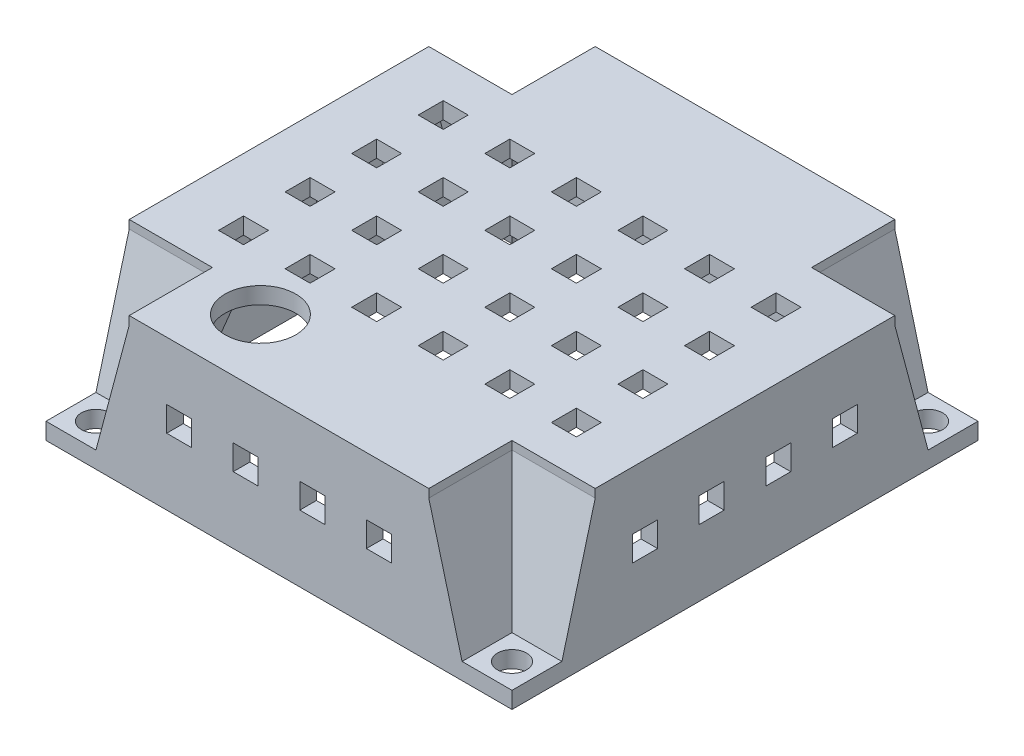
from build123d import *
from OCP.BRepFilletAPI import BRepFilletAPI_MakeChamfer

# Parameters (mm, degrees)
SKETCH_1_W                  = 56
SKETCH_1_H                  = 56
EXTRUDE_1_DEPTH             = 18
SKETCH_2_W                  = 11
SKETCH_2_H                  = 11
CUT_EXTRUDE_2_DEPTH         = 16
CHAMFER_1_SIZE              = 15
CHAMFER_1_SIZE2             = 4
SKETCH_5_R                  = 1.75
CUT_EXTRUDE_4_DEPTH         = 15
SKETCH_6_W                  = 3
SKETCH_6_H                  = 3
CUT_EXTRUDE_5_DEPTH         = 2
PATTERN_LINEAR_1_COUNT      = 6
PATTERN_LINEAR_1_PITCH      = 8
PATTERN_LINEAR_1_COUNT_DIR2 = 4
PATTERN_LINEAR_1_PITCH_DIR2 = 8
SKETCH_7_W                  = 3
SKETCH_7_H                  = 3
CUT_EXTRUDE_6_DEPTH         = 66.1459899
PATTERN_LINEAR_2_COUNT      = 4
PATTERN_LINEAR_2_PITCH      = 8
SKETCH_8_W                  = 3
SKETCH_8_H                  = 3
CUT_EXTRUDE_7_DEPTH         = 66.145989943
PATTERN_LINEAR_3_COUNT      = 4
PATTERN_LINEAR_3_PITCH      = 8
SKETCH_9_R                  = 4.25
CUT_EXTRUDE_8_DEPTH         = 10


with BuildPart() as part:
    # Эскиз1 → Бобышка-Вытянуть1 (new body)
    with BuildSketch(Plane(origin=(0, 0, 0), x_dir=(1, 0, 0), z_dir=(0, 1, 0))):
        Rectangle(SKETCH_1_W, SKETCH_1_H)
    extrude(amount=EXTRUDE_1_DEPTH)

    # Эскиз2 → Вырез-Вытянуть2 (cut)
    with BuildSketch(Plane(origin=(0, 18, 0), x_dir=(1, 0, 0), z_dir=(0, 1, 0))):
        with Locations((-23.5, 23.5)):
            Rectangle(SKETCH_2_W, SKETCH_2_H)
        with Locations((23.5, 23.5)):
            Rectangle(SKETCH_2_W, SKETCH_2_H)
        with Locations((-23.5, -23.5)):
            Rectangle(SKETCH_2_W, SKETCH_2_H)
        with Locations((23.5, -23.5)):
            Rectangle(SKETCH_2_W, SKETCH_2_H)
    extrude(amount=-CUT_EXTRUDE_2_DEPTH, mode=Mode.SUBTRACT)

    # Фаска1: one chamfer whose edges measure the first distance from different faces: ONE call of the kernel's chamfer builder (chamfer() names one face for all edges)
    chamfer_1_edges_1 = [part.edges().sort_by_distance(p)[0] for p in [
        (23, 2, -18),
    ]]
    chamfer_1_side_1 = [part.faces().sort_by_distance(p)[0] for p in [
        (23, 10, -18),
    ]]
    chamfer_1_edges_2 = [part.edges().sort_by_distance(p)[0] for p in [
        (18, 2, -23),
    ]]
    chamfer_1_side_2 = [part.faces().sort_by_distance(p)[0] for p in [
        (18, 10, -23),
    ]]
    chamfer_1_edges_3 = [part.edges().sort_by_distance(p)[0] for p in [
        (-23, 2, 18),
    ]]
    chamfer_1_side_3 = [part.faces().sort_by_distance(p)[0] for p in [
        (-23, 10, 18),
    ]]
    chamfer_1_edges_4 = [part.edges().sort_by_distance(p)[0] for p in [
        (-18, 2, 23),
    ]]
    chamfer_1_side_4 = [part.faces().sort_by_distance(p)[0] for p in [
        (-18, 10, 23),
    ]]
    chamfer_1_edges_5 = [part.edges().sort_by_distance(p)[0] for p in [
        (18, 2, 23),
    ]]
    chamfer_1_side_5 = [part.faces().sort_by_distance(p)[0] for p in [
        (18, 10, 23),
    ]]
    chamfer_1_edges_6 = [part.edges().sort_by_distance(p)[0] for p in [
        (23, 2, 18),
    ]]
    chamfer_1_side_6 = [part.faces().sort_by_distance(p)[0] for p in [
        (23, 10, 18),
    ]]
    chamfer_1_edges_7 = [part.edges().sort_by_distance(p)[0] for p in [
        (-18, 2, -23),
    ]]
    chamfer_1_side_7 = [part.faces().sort_by_distance(p)[0] for p in [
        (-18, 10, -23),
    ]]
    chamfer_1_edges_8 = [part.edges().sort_by_distance(p)[0] for p in [
        (-23, 2, -18),
    ]]
    chamfer_1_side_8 = [part.faces().sort_by_distance(p)[0] for p in [
        (-23, 10, -18),
    ]]
    chamfer_1 = BRepFilletAPI_MakeChamfer(part.part.solid().wrapped)
    for e in chamfer_1_edges_1:
        chamfer_1.Add(CHAMFER_1_SIZE, CHAMFER_1_SIZE2, e.wrapped, chamfer_1_side_1[0].wrapped)  # the first distance lies on this face
    for e in chamfer_1_edges_2:
        chamfer_1.Add(CHAMFER_1_SIZE, CHAMFER_1_SIZE2, e.wrapped, chamfer_1_side_2[0].wrapped)  # the first distance lies on this face
    for e in chamfer_1_edges_3:
        chamfer_1.Add(CHAMFER_1_SIZE, CHAMFER_1_SIZE2, e.wrapped, chamfer_1_side_3[0].wrapped)  # the first distance lies on this face
    for e in chamfer_1_edges_4:
        chamfer_1.Add(CHAMFER_1_SIZE, CHAMFER_1_SIZE2, e.wrapped, chamfer_1_side_4[0].wrapped)  # the first distance lies on this face
    for e in chamfer_1_edges_5:
        chamfer_1.Add(CHAMFER_1_SIZE, CHAMFER_1_SIZE2, e.wrapped, chamfer_1_side_5[0].wrapped)  # the first distance lies on this face
    for e in chamfer_1_edges_6:
        chamfer_1.Add(CHAMFER_1_SIZE, CHAMFER_1_SIZE2, e.wrapped, chamfer_1_side_6[0].wrapped)  # the first distance lies on this face
    for e in chamfer_1_edges_7:
        chamfer_1.Add(CHAMFER_1_SIZE, CHAMFER_1_SIZE2, e.wrapped, chamfer_1_side_7[0].wrapped)  # the first distance lies on this face
    for e in chamfer_1_edges_8:
        chamfer_1.Add(CHAMFER_1_SIZE, CHAMFER_1_SIZE2, e.wrapped, chamfer_1_side_8[0].wrapped)  # the first distance lies on this face
    add(Compound.cast(chamfer_1.Shape()), mode=Mode.REPLACE)

    # Оболочка2: read off the stored shape, not the designer's step
    # Оболочка2: loft between two sections, ruled curve by curve
    shell_2_from = [
        Edge.make_line((-26, 0, -20.463443374), (-26, 0, 20.463443374)),
        Edge.make_line((20.463443374, 0, 26), (-20.463443374, 0, 26)),
        Edge.make_line((26, 0, 20.463443374), (26, 0, -20.463443374)),
        Edge.make_line((-20.463443374, 0, -26), (20.463443374, 0, -26)),
        Edge.make_line((26, 0, 20.463443374), (20.463443374, 0, 20.463443374)),
        Edge.make_line((-26, 0, 20.463443374), (-20.463443374, 0, 20.463443374)),
        Edge.make_line((20.463443374, 0, 20.463443374), (20.463443374, 0, 26)),
        Edge.make_line((20.463443374, 0, -26), (20.463443374, 0, -20.463443374)),
        Edge.make_line((-20.463443374, 0, 26), (-20.463443374, 0, 20.463443374)),
        Edge.make_line((-20.463443374, 0, -26), (-20.463443374, 0, -20.463443374)),
        Edge.make_line((20.463443374, 0, -20.463443374), (26, 0, -20.463443374)),
        Edge.make_line((-26, 0, -20.463443374), (-20.463443374, 0, -20.463443374)),
    ]
    shell_2_to = [
        Edge.make_line((-26, 16, -16.196776707), (-26, 16, 16.196776707)),
        Edge.make_line((16.196776707, 16, 26), (-16.196776707, 16, 26)),
        Edge.make_line((26, 16, 16.196776707), (26, 16, -16.196776707)),
        Edge.make_line((-16.196776707, 16, -26), (16.196776707, 16, -26)),
        Edge.make_line((26, 16, 16.196776707), (16.196776707, 16, 16.196776707)),
        Edge.make_line((-26, 16, 16.196776707), (-16.196776707, 16, 16.196776707)),
        Edge.make_line((16.196776707, 16, 16.196776707), (16.196776707, 16, 26)),
        Edge.make_line((16.196776707, 16, -26), (16.196776707, 16, -16.196776707)),
        Edge.make_line((-16.196776707, 16, 26), (-16.196776707, 16, 16.196776707)),
        Edge.make_line((-16.196776707, 16, -26), (-16.196776707, 16, -16.196776707)),
        Edge.make_line((16.196776707, 16, -16.196776707), (26, 16, -16.196776707)),
        Edge.make_line((-26, 16, -16.196776707), (-16.196776707, 16, -16.196776707)),
    ]
    shell_2 = Solid(Shell([*[Face.make_surface_from_curves(shell_2_from[k], shell_2_to[k]) for k in range(12)], Face(Wire(shell_2_from)), Face(Wire(shell_2_to))]))
    add(shell_2, mode=Mode.SUBTRACT)

    # Эскиз5 → Вырез-Вытянуть4 (cut)
    with BuildSketch(Plane(origin=(0, 2, 0), x_dir=(1, 0, 0), z_dir=(0, 1, 0))):
        with Locations(Location((-25, 25, 0), (0, 0, 270))):
            Circle(SKETCH_5_R)
        with Locations(Location((25, 25, 0), (0, 0, 270))):
            Circle(SKETCH_5_R)
        with Locations(Location((-25, -25, 0), (0, 0, 270))):
            Circle(SKETCH_5_R)
        with Locations(Location((25, -25, 0), (0, 0, 270))):
            Circle(SKETCH_5_R)
    extrude(amount=-CUT_EXTRUDE_4_DEPTH, mode=Mode.SUBTRACT)

    # Эскиз6 → Вырез-Вытянуть5 (cut)
    with BuildSketch(Plane(origin=(0, 18, 0), x_dir=(1, 0, 0), z_dir=(0, 1, 0))):
        with Locations((-20, 11.733333333)):
            Rectangle(SKETCH_6_W, SKETCH_6_H)
    cut_extrude_5 = extrude(amount=-CUT_EXTRUDE_5_DEPTH, mode=Mode.SUBTRACT)

    # Линейный массив1: Cut-Extrude 5 6 × 4
    with Locations(*[(i * PATTERN_LINEAR_1_PITCH, 0, j * PATTERN_LINEAR_1_PITCH_DIR2) for i in range(PATTERN_LINEAR_1_COUNT) for j in range(PATTERN_LINEAR_1_COUNT_DIR2) if (i, j) != (0, 0)]):
        add(cut_extrude_5, mode=Mode.SUBTRACT)

    # Эскиз7 → Вырез-Вытянуть6 (cut, through all)
    with BuildSketch(Plane.XY.offset(28)):
        with Locations((-12, 9.5)):
            Rectangle(SKETCH_7_W, SKETCH_7_H)
    cut_extrude_6 = extrude(amount=-CUT_EXTRUDE_6_DEPTH, mode=Mode.SUBTRACT)

    # Линейный массив2: Вырез-Вытянуть6 ×4
    with Locations(*[(i * PATTERN_LINEAR_2_PITCH, 0, 0) for i in range(1, PATTERN_LINEAR_2_COUNT)]):
        add(cut_extrude_6, mode=Mode.SUBTRACT)

    # Эскиз8 → Вырез-Вытянуть7 (cut, through all)
    with BuildSketch(Plane(origin=(28, 0, 0), x_dir=(0, 0, -1), z_dir=(1, 0, 0))):
        with Locations((-12, 9.5)):
            Rectangle(SKETCH_8_W, SKETCH_8_H)
    cut_extrude_7 = extrude(amount=-CUT_EXTRUDE_7_DEPTH, mode=Mode.SUBTRACT)

    # Линейный массив3: Вырез-Вытянуть7 ×4
    with Locations(*[(0, 0, -i * PATTERN_LINEAR_3_PITCH) for i in range(1, PATTERN_LINEAR_3_COUNT)]):
        add(cut_extrude_7, mode=Mode.SUBTRACT)

    # Эскиз9 → Вырез-Вытянуть8 (cut)
    with BuildSketch(Plane(origin=(0, 18, 0), x_dir=(1, 0, 0), z_dir=(0, 1, 0))):
        with Locations(Location((-10.233333333, -20, 0), (0, 0, 270))):
            Circle(SKETCH_9_R)
    extrude(amount=-CUT_EXTRUDE_8_DEPTH, mode=Mode.SUBTRACT)


solid = part.part
